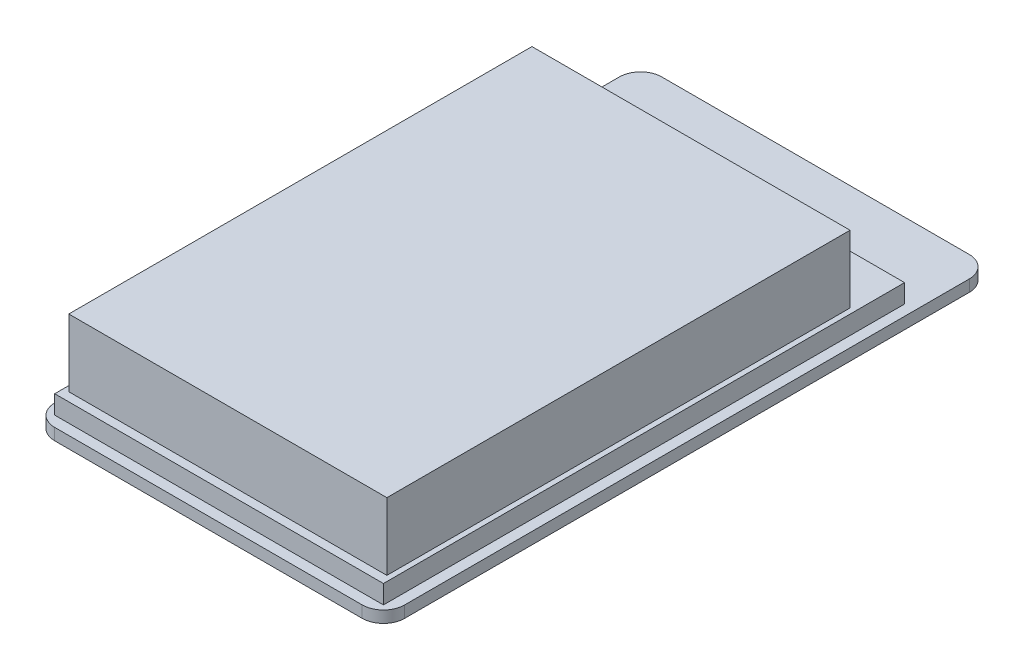
from build123d import *

# Parameters (mm, degrees)
SKETCH_1_W      = 66
SKETCH_1_H      = 114.5
EXTRUDE_1_DEPTH = 2.2
FILLET_1_R      = 4
SKETCH_2_W      = 62
SKETCH_2_H      = 98.3
EXTRUDE_2_DEPTH = 3.5
SKETCH_3_W      = 60
SKETCH_3_H      = 87.364717042
EXTRUDE_3_DEPTH = 12.7


with BuildPart() as part:
    # 스케치1 → 보스-돌출1 (new body)
    with BuildSketch(Plane(origin=(0, 0, 0), x_dir=(1, 0, 0), z_dir=(0, 1, 0))):
        Rectangle(SKETCH_1_W, SKETCH_1_H)
    extrude(amount=EXTRUDE_1_DEPTH)

    # 필렛1
    fillet_1_edges = [part.edges().sort_by_distance(p)[0] for p in [
        (33, 1.1, -57.25),
        (-33, 1.1, -57.25),
        (-33, 1.1, 57.25),
        (33, 1.1, 57.25),
    ]]
    fillet(fillet_1_edges, radius=FILLET_1_R)

    # 스케치2 → 보스-돌출2 (add)
    with BuildSketch(Plane(origin=(0, 2.2, 0), x_dir=(1, 0, 0), z_dir=(0, 1, 0))):
        with Locations((0, -6.1)):
            Rectangle(SKETCH_2_W, SKETCH_2_H)
    extrude(amount=EXTRUDE_2_DEPTH)

    # 스케치3 → 보스-돌출3 (add)
    with BuildSketch(Plane(origin=(0, 5.7, 0), x_dir=(1, 0, 0), z_dir=(0, 1, 0))):
        with Locations((0, -9.917641479)):
            Rectangle(SKETCH_3_W, SKETCH_3_H)
    extrude(amount=EXTRUDE_3_DEPTH)


solid = part.part
